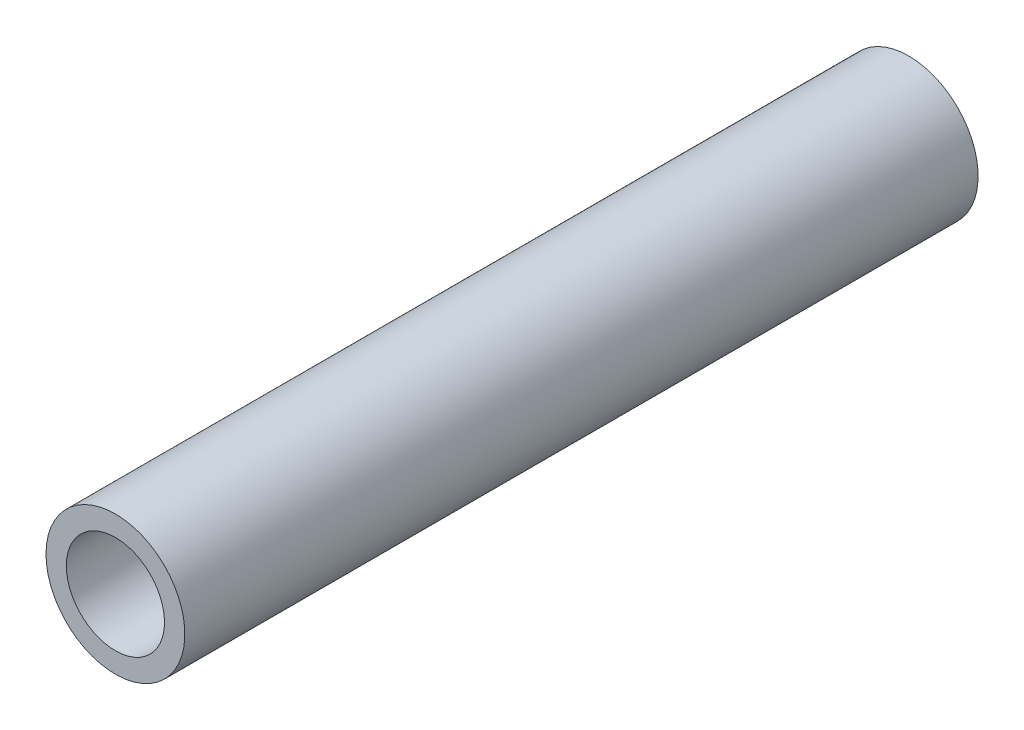
from build123d import *

# Parameters (mm, degrees)
SKETCH1_R           = 13.335
SKETCH1_R_2         = 9.4234
EXTRUDE_THIN1_DEPTH = 76.2


with BuildPart() as part:
    # Sketch1 → Extrude-Thin1 (new, symmetric)
    with BuildSketch(Plane.XY):
        Circle(SKETCH1_R)
        Circle(SKETCH1_R_2, mode=Mode.SUBTRACT)
    extrude(amount=EXTRUDE_THIN1_DEPTH, both=True)


solid = part.part
